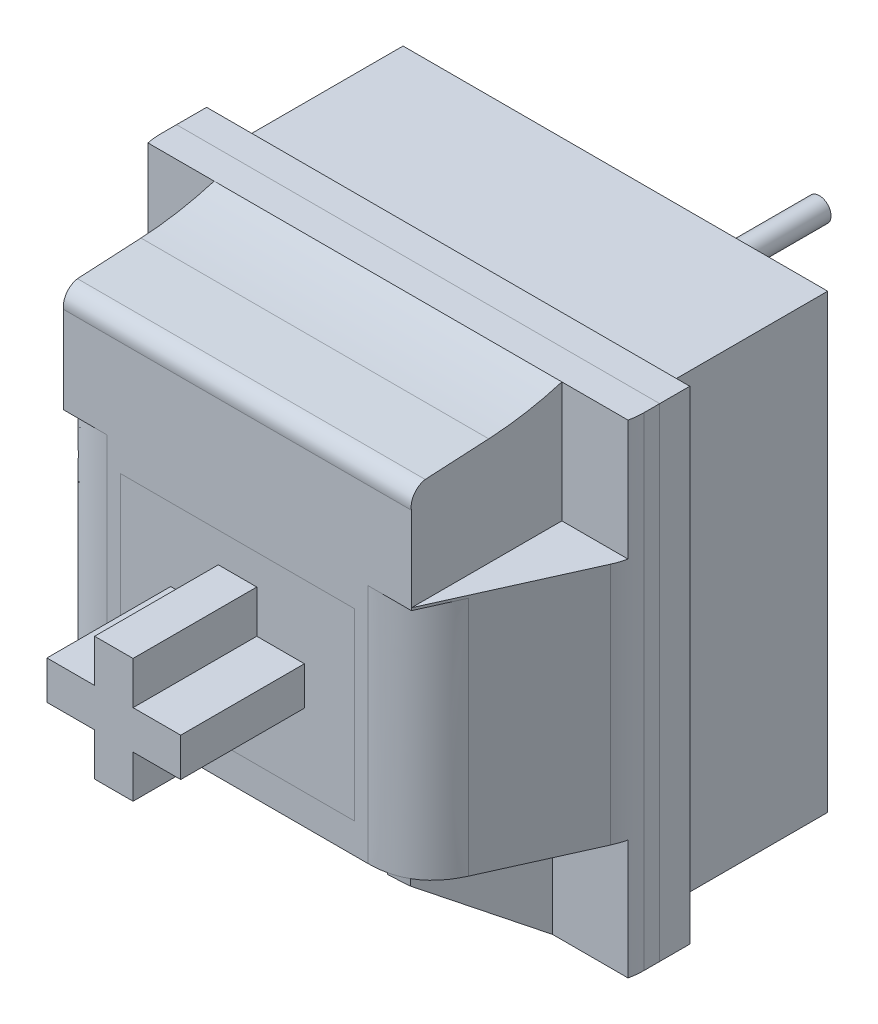
from build123d import *

# Parameters (mm, degrees)
BOSS_EXTRUDE1_DEPTH  = 3.7
SKETCH2_W            = 7
SKETCH2_H            = 5.5
BOSS_EXTRUDE2_DEPTH  = 5
SKETCH3_W            = 7
SKETCH3_H            = 3.4
BOSS_EXTRUDE3_DEPTH  = 4.5
SKETCH4_W            = 14.45
SKETCH4_H            = 14.45
BOSS_EXTRUDE4_DEPTH  = 0.9
BOSS_EXTRUDE5_DEPTH  = 10.4
BOSS_EXTRUDE6_DEPTH  = 7.275
FILLET3_START        = -8
FILLET3_DEPTH        = 12.125
FILLET3_START_2      = 4.125
FILLET3_2_DEPTH      = 4.875
SKETCH8_W            = 8.85
SKETCH8_H            = 1.475
CUT_EXTRUDE1_DEPTH   = 15.600706435
BOSS_EXTRUDE7_DEPTH  = 0.5
CUT_EXTRUDE2_DEPTH   = 16.248811596
BOSS_EXTRUDE8_DEPTH  = 0.5
CUT_EXTRUDE3_DEPTH   = 0.5
SKETCH13_W           = 14.45
SKETCH13_H           = 14.45
BOSS_EXTRUDE9_DEPTH  = 0.9
SKETCH14_W           = 12.7
SKETCH14_H           = 13.5
BOSS_EXTRUDE10_DEPTH = 5
SKETCH15_R           = 1.9
BOSS_EXTRUDE11_DEPTH = 3.3
FILLET4_R            = 0.7
SKETCH16_W           = 8.85
SKETCH16_H           = 1.475
CUT_EXTRUDE4_DEPTH   = 16.184881574
SKETCH17_W           = 10.496766354
SKETCH17_H           = 3.1
CUT_EXTRUDE5_DEPTH   = 2.3
SKETCH18_R           = 0.35
BOSS_EXTRUDE12_DEPTH = 3.6


with BuildPart() as part:
    # Sketch1 → Boss-Extrude1 (new body)
    with BuildSketch(Plane.XY):
        Polygon((0, 0), (1.425, 0), (1.425, -1.275), (2.575, -1.275), (2.575, 0), (4, 0), (4, 1.15), (2.575, 1.15), (2.575, 2.425), (1.425, 2.425), (1.425, 1.15), (0, 1.15), align=None)
    extrude(amount=BOSS_EXTRUDE1_DEPTH)

    # Sketch2 → Boss-Extrude2 (add)
    with BuildSketch(Plane(origin=(0, 0, 0), x_dir=(-1, 0, 0), z_dir=(0, 0, -1))):
        with Locations((-2, 0.575)):
            Rectangle(SKETCH2_W, SKETCH2_H)
    extrude(amount=BOSS_EXTRUDE2_DEPTH)


with BuildPart() as body_2:
    # Sketch3 → Boss-Extrude3 (new body)
    with BuildSketch(Plane.XY):
        Polygon((-3.2, 6.725), (-3.2, -2.175), (-1.5, -2.175), (-1.5, 3.325), (-1.5, 6.725), align=None)
        Polygon((-3.2, -2.175), (-3.2, -3.075), (7.2, -3.075), (7.2, -2.175), (5.5, -2.175), (-1.5, -2.175), align=None)
        Polygon((5.5, -2.175), (7.2, -2.175), (7.2, 6.725), (5.5, 6.725), (5.5, 3.325), align=None)
        with Locations((2, 5.025)):
            Rectangle(SKETCH3_W, SKETCH3_H)
    extrude(amount=-BOSS_EXTRUDE3_DEPTH)



with BuildPart() as body_3:
    # Sketch4 → Boss-Extrude4 (new body)
    with BuildSketch(Plane(origin=(0, 0, -4.5), x_dir=(-1, 0, 0), z_dir=(0, 0, -1))):
        with Locations((-2, 0.575)):
            Rectangle(SKETCH4_W, SKETCH4_H)
    extrude(amount=BOSS_EXTRUDE4_DEPTH)


with BuildPart() as body_2_1:
    add(body_2.part)

    add(body_3.part)  # Boss-Extrude5 merges body 3
    # Sketch6 → Boss-Extrude5 (add)
    with BuildSketch(Plane.ZY.offset(3.2)):
        with BuildLine():
            Line((-0.411871522, 7.317602539), (-2.312635971, 7.419289526))
            ThreePointArc((-2.312635971, 7.419289526), (-3.417645725, 7.544561473), (-4.5, 7.8))
            Line((-4.5, 7.8), (-4.5, 6.725))
            Line((-4.5, 6.725), (0, 6.725))
            ThreePointArc((0, 6.725), (-0.083203757, 7.106602655), (-0.411871522, 7.317602539))
        make_face()
    extrude(amount=-BOSS_EXTRUDE5_DEPTH)

    # Sketch7 → Boss-Extrude6 (add)
    with BuildSketch(Plane.XZ.offset(3.075)):
        Polygon((7.2, 0), (9.225, -4.5), (7.2, -4.5), align=None)
        Polygon((-3.2, 0), (-5.225, -4.5), (-3.2, -4.5), align=None)
    extrude(amount=-BOSS_EXTRUDE6_DEPTH)

    # Fillet3: read off the stored shape, not the designer's step
    # Fillet3 outline → Fillet3 (cut)
    with BuildSketch(Plane(origin=(0, 0, 0), x_dir=(1, 0, 0), z_dir=(0, 1, 0)).offset(FILLET3_START)):
        with BuildLine():
            Line((-5.225, 4.5), (-5.04884301, 4.108540023))
            add(Edge.make_bspline(
                [(-5.225, 4.929269378), (-5.225, 4.5), (-5.04884301, 4.108540023)],
                knots=[0, 0, 0, 1, 1, 1], degree=2))
            Line((-5.225, 4.929269378), (-5.225, 4.5))
        make_face()
        with BuildLine():
            Line((-3.2, 0), (-1.90682878, 0))
            add(Edge.make_bspline(
                [(-3.73067179, 1.179270645), (-3.2, 0), (-1.90682878, 0)],
                knots=[0, 0, 0, 1, 1, 1], degree=2))
            Line((-3.73067179, 1.179270645), (-3.2, 0))
        make_face()
        with BuildLine():
            Line((7.2, 0), (7.73067179, 1.179270645))
            add(Edge.make_bspline(
                [(5.90682878, 0), (7.2, 0), (7.73067179, 1.179270645)],
                knots=[0, 0, 0, 1, 1, 1], degree=2))
            Line((5.90682878, 0), (7.2, 0))
        make_face()
        with BuildLine():
            add(Edge.make_bspline(
                [(9.04884301, 4.108540023), (9.225, 4.5), (9.225, 4.929269378)],
                knots=[0, 0, 0, 1, 1, 1], degree=2))
            Line((9.04884301, 4.108540023), (9.225, 4.5))
            Line((9.225, 4.5), (9.225, 4.929269378))
        make_face()
    extrude(amount=FILLET3_DEPTH, mode=Mode.SUBTRACT)

    # Fillet3 2 outline → Fillet3 2 (cut)
    with BuildSketch(Plane(origin=(0, 0, 0), x_dir=(1, 0, 0), z_dir=(0, 1, 0)).offset(FILLET3_START_2)):
        with BuildLine():
            Line((-5.225, 4.5), (-5.04884301, 4.108540023))
            add(Edge.make_bspline(
                [(-5.225, 4.929269378), (-5.225, 4.5), (-5.04884301, 4.108540023)],
                knots=[0, 0, 0, 1, 1, 1], degree=2))
            Line((-5.225, 4.929269378), (-5.225, 4.5))
        make_face()
        with BuildLine():
            add(Edge.make_bspline(
                [(9.04884301, 4.108540023), (9.225, 4.5), (9.225, 4.929269378)],
                knots=[0, 0, 0, 1, 1, 1], degree=2))
            Line((9.04884301, 4.108540023), (9.225, 4.5))
            Line((9.225, 4.5), (9.225, 4.929269378))
        make_face()
    extrude(amount=FILLET3_2_DEPTH, mode=Mode.SUBTRACT)

    # Sketch8 → Cut-Extrude1 (cut, through all)
    with BuildSketch(Plane.XY.offset(-4.5)):
        with Locations((2, -4.9125)):
            Rectangle(SKETCH8_W, SKETCH8_H)
    extrude(amount=-CUT_EXTRUDE1_DEPTH, mode=Mode.SUBTRACT)

    # Sketch9 → Boss-Extrude7 (add)
    with BuildSketch(Plane.ZY.offset(-6.425)):
        Polygon((0, -3.075), (-4.5, -6.65), (-4.5, -3.075), align=None)
    extrude(amount=-BOSS_EXTRUDE7_DEPTH)

    # Sketch10 → Cut-Extrude2 (cut, through all)
    with BuildSketch(Plane(origin=(0, -3.075, 0), x_dir=(1, 0, 0), z_dir=(0, 1, 0))):
        with BuildLine():
            Line((6.925, 0), (6.925, 0.243708852))
            add(Edge.make_bspline(
                [(6.925, 0.243708852), (6.697101215, 0.114632789), (6.425, 0.053919569)],
                knots=[0, 0, 0, 1, 1, 1], degree=2))
            Line((6.425, 0.053919569), (6.425, 0))
            Line((6.425, 0), (6.925, 0))
        make_face()
    extrude(amount=-CUT_EXTRUDE2_DEPTH, mode=Mode.SUBTRACT)

    # Sketch11 → Boss-Extrude8 (add)
    with BuildSketch(Plane(origin=(-2.425, 0, 0), x_dir=(0, 0, -1), z_dir=(1, 0, 0))):
        Polygon((0.053919569, -3.117836102), (4.5, -6.65), (4.5, -5.65), (5.4, -5.65), (5.4, -4.175), (4.5, -4.175), (4.5, -3.075), (0.053919569, -3.075), align=None)
    extrude(amount=-BOSS_EXTRUDE8_DEPTH)

    # Sketch12 → Cut-Extrude3 (cut)
    with BuildSketch(Plane(origin=(0, -3.075, 0), x_dir=(1, 0, 0), z_dir=(0, 1, 0))):
        with BuildLine():
            Line((-2.925, 0.053919569), (-2.425, 0.053919569))
            add(Edge.make_bspline(
                [(-2.425, 0.053919569), (-2.697101223, 0.114632791), (-2.925000013, 0.24370886)],
                knots=[0, 0, 0, 1, 1, 1], degree=2))
            Line((-2.925000013, 0.24370886), (-2.925, 0.053919569))
        make_face()
    extrude(amount=-CUT_EXTRUDE3_DEPTH, mode=Mode.SUBTRACT)


with BuildPart() as body_3_2:
    # Sketch13 → Boss-Extrude9 (new body)
    with BuildSketch(Plane(origin=(0, 0, -5.4), x_dir=(-1, 0, 0), z_dir=(0, 0, -1))):
        with Locations((-2, 0.575)):
            Rectangle(SKETCH13_W, SKETCH13_H)
    extrude(amount=BOSS_EXTRUDE9_DEPTH)

    # Sketch14 → Boss-Extrude10 (add)
    with BuildSketch(Plane(origin=(0, 0, -6.3), x_dir=(-1, 0, 0), z_dir=(0, 0, -1))):
        with Locations((-2, 0.575)):
            Rectangle(SKETCH14_W, SKETCH14_H)
    extrude(amount=BOSS_EXTRUDE10_DEPTH)

    # Sketch15 → Boss-Extrude11 (add)
    with BuildSketch(Plane(origin=(0, 0, -11.3), x_dir=(-1, 0, 0), z_dir=(0, 0, -1))):
        with Locations((-2, 0.575)):
            Circle(SKETCH15_R)
    extrude(amount=BOSS_EXTRUDE11_DEPTH)

    # Fillet4
    fillet4_edges = [body_3_2.edges().sort_by_distance(p)[0] for p in [
        (3.9, 0.575, -14.6),
    ]]
    fillet(fillet4_edges, radius=FILLET4_R)

    # Sketch16 → Cut-Extrude4 (cut, through all)
    with BuildSketch(Plane.XY.offset(-5.4)):
        with Locations((2, -4.9125)):
            Rectangle(SKETCH16_W, SKETCH16_H)
    extrude(amount=-CUT_EXTRUDE4_DEPTH, mode=Mode.SUBTRACT)

    # Sketch17 → Cut-Extrude5 (cut)
    with BuildSketch(Plane(origin=(0, 0, -11.3), x_dir=(-1, 0, 0), z_dir=(0, 0, -1))):
        with Locations((-1.99026274, -4.625)):
            Rectangle(SKETCH17_W, SKETCH17_H)
    extrude(amount=-CUT_EXTRUDE5_DEPTH, mode=Mode.SUBTRACT)

    # Sketch18 → Boss-Extrude12 (add)
    with BuildSketch(Plane(origin=(0, 0, -11.3), x_dir=(-1, 0, 0), z_dir=(0, 0, -1))):
        with Locations(Location((-4.5, 5.725, 0), (0, 0, 180))):
            Circle(SKETCH18_R)
        with Locations(Location((2.17, 3.075, 0), (0, 0, 180))):
            Circle(SKETCH18_R)
    extrude(amount=BOSS_EXTRUDE12_DEPTH)


solid = Compound([part.part, body_2_1.part, body_3_2.part])
